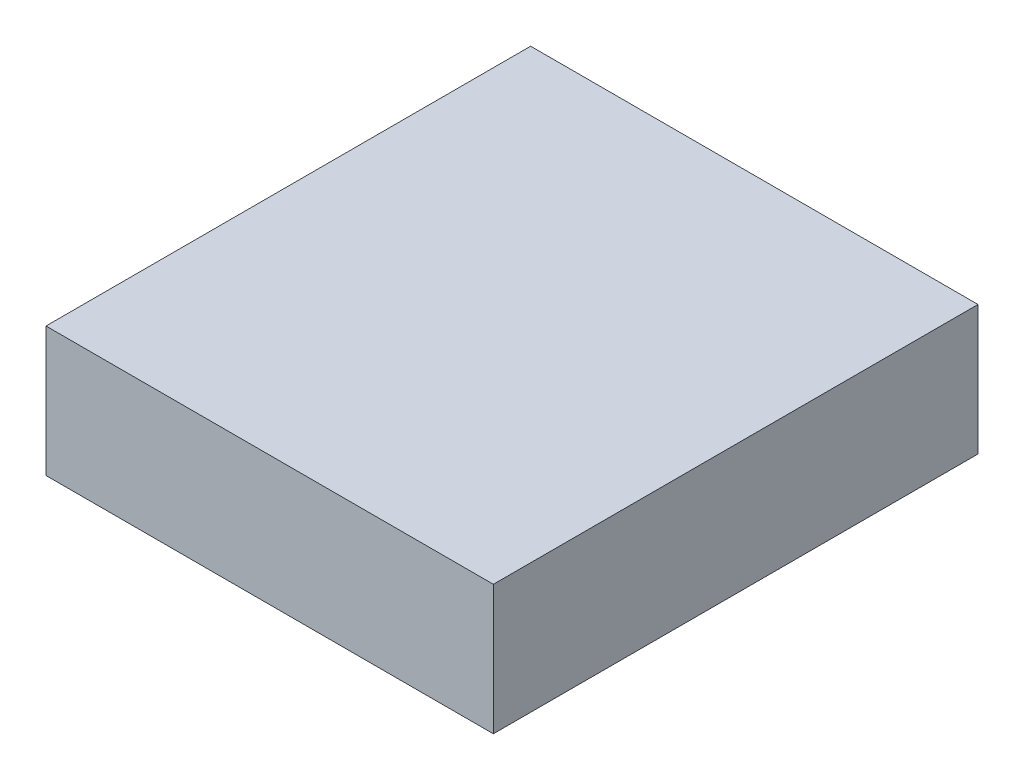
from build123d import *

# Parameters (mm, degrees)
SKETCH1_W           = 34.542788291
SKETCH1_H           = 37.421353982
BOSS_EXTRUDE1_DEPTH = 10


with BuildPart() as part:
    # Sketch1 → Boss-Extrude1 (new body)
    with BuildSketch(Plane(origin=(0, 0, 0), x_dir=(1, 0, 0), z_dir=(0, 1, 0))):
        with Locations((17.271394146, 18.710676991)):
            Rectangle(SKETCH1_W, SKETCH1_H)
    extrude(amount=BOSS_EXTRUDE1_DEPTH)


solid = part.part
